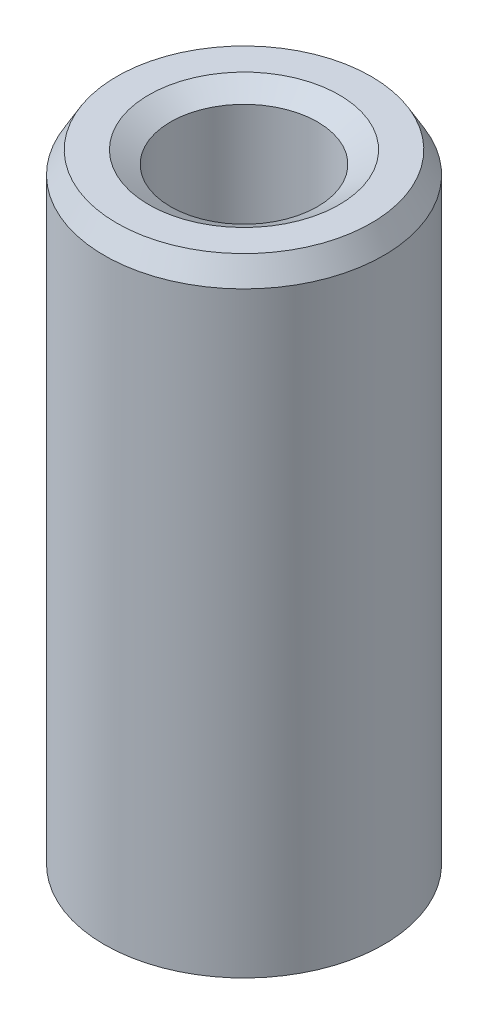
from build123d import *
from OCP.BRepFilletAPI import BRepFilletAPI_MakeChamfer

# Parameters (mm, degrees)
SKETCH1_R           = 25
BOSS_EXTRUDE1_DEPTH = 112.929822923
SKETCH2_R           = 13.147515474
CUT_EXTRUDE1_DEPTH  = 119.334884567
CHAMFER1_SIZE       = 3.888451178
CHAMFER1_SIZE2      = 2.244998334


with BuildPart() as part:
    # Sketch1 → Boss-Extrude1 (new body)
    with BuildSketch(Plane(origin=(0, 0, 0), x_dir=(1, 0, 0), z_dir=(0, 1, 0))):
        Circle(SKETCH1_R)
    extrude(amount=BOSS_EXTRUDE1_DEPTH)

    # Sketch2 → Cut-Extrude1 (cut, through all)
    with BuildSketch(Plane(origin=(0, 0, 0), x_dir=(1, 0, 0), z_dir=(0, 1, 0))):
        Circle(SKETCH2_R)
    extrude(amount=CUT_EXTRUDE1_DEPTH, mode=Mode.SUBTRACT)

    # Chamfer1: one chamfer whose edges measure the first distance from different faces: ONE call of the kernel's chamfer builder (chamfer() names one face for all edges)
    chamfer1_edges_1 = [part.edges().sort_by_distance(p)[0] for p in [
        (-13.147515474, 112.929822923, 0),
    ]]
    chamfer1_side_1 = [part.faces().sort_by_distance(p)[0] for p in [
        (-24.292893219, 112.929822923, 0),
    ]]
    chamfer1_edges_2 = [part.edges().sort_by_distance(p)[0] for p in [
        (-13.147515474, 0, 0),
    ]]
    chamfer1_side_2 = [part.faces().sort_by_distance(p)[0] for p in [
        (-13.147515474, 56.464911462, 0),
    ]]
    chamfer1_edges_3 = [part.edges().sort_by_distance(p)[0] for p in [
        (-25, 0, 0),
    ]]
    chamfer1_side_3 = [part.faces().sort_by_distance(p)[0] for p in [
        (-24.292893219, 0, 0),
    ]]
    chamfer1_edges_4 = [part.edges().sort_by_distance(p)[0] for p in [
        (-25, 112.929822923, 0),
    ]]
    chamfer1_side_4 = [part.faces().sort_by_distance(p)[0] for p in [
        (-25, 56.464911462, 0),
    ]]
    chamfer1 = BRepFilletAPI_MakeChamfer(part.part.solid().wrapped)
    for e in chamfer1_edges_1:
        chamfer1.Add(CHAMFER1_SIZE, CHAMFER1_SIZE2, e.wrapped, chamfer1_side_1[0].wrapped)  # the first distance lies on this face
    for e in chamfer1_edges_2:
        chamfer1.Add(CHAMFER1_SIZE, CHAMFER1_SIZE2, e.wrapped, chamfer1_side_2[0].wrapped)  # the first distance lies on this face
    for e in chamfer1_edges_3:
        chamfer1.Add(CHAMFER1_SIZE, CHAMFER1_SIZE2, e.wrapped, chamfer1_side_3[0].wrapped)  # the first distance lies on this face
    for e in chamfer1_edges_4:
        chamfer1.Add(CHAMFER1_SIZE, CHAMFER1_SIZE2, e.wrapped, chamfer1_side_4[0].wrapped)  # the first distance lies on this face
    add(Compound.cast(chamfer1.Shape()), mode=Mode.REPLACE)


solid = part.part
